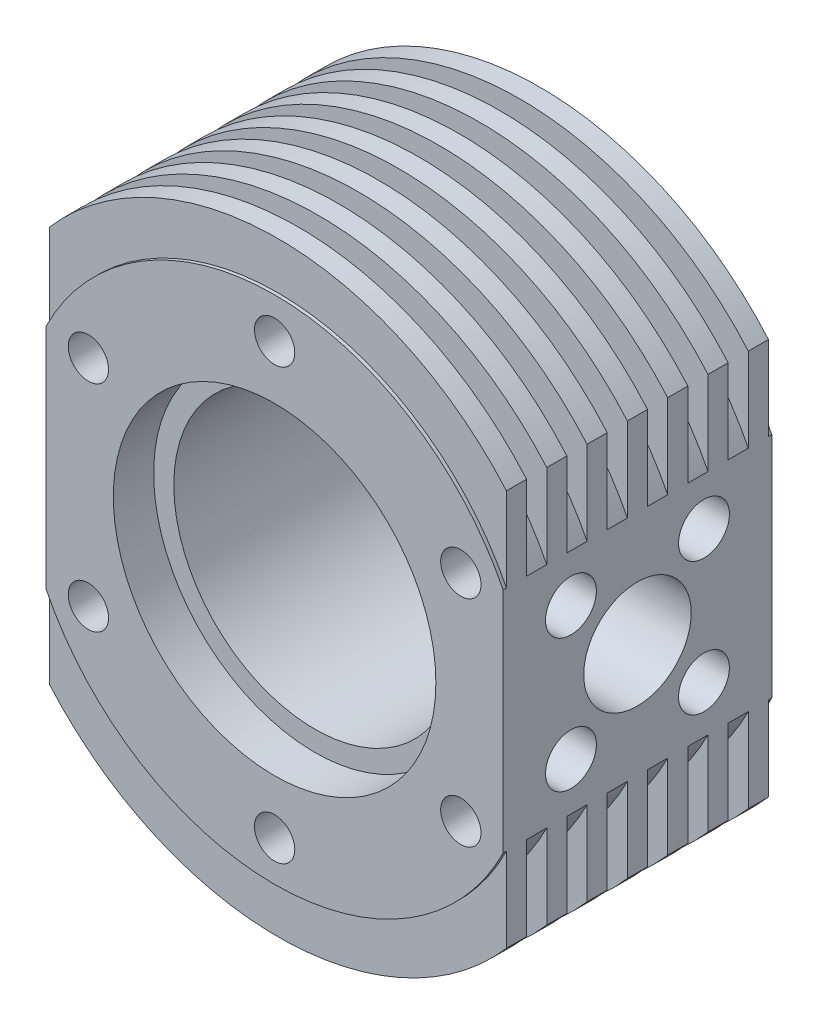
from build123d import *

# Parameters (mm, degrees)
SKETCH1_R            = 10.5
BOSS_EXTRUDE1_DEPTH  = 20
SKETCH2_R            = 12
CUT_EXTRUDE1_DEPTH   = 3
SKETCH4_OUTSIDE_W    = 47.968
SKETCH4_OUTSIDE_H    = 58.968
SKETCH4_OUTSIDE_R    = 19
CUT_EXTRUDE2_DEPTH   = 0.25
SKETCH5_OUTSIDE_W    = 47.968
SKETCH5_OUTSIDE_H    = 58.968
SKETCH5_OUTSIDE_R    = 19
CUT_EXTRUDE3_DEPTH   = 0.25
CUT_EXTRUDE4_START   = -1.5
CUT_EXTRUDE4_DEPTH   = 1.5
LPATTERN1_COUNT      = 6
LPATTERN1_PITCH      = 3
MIRROR1_START        = -1.5
MIRROR1_COPY_1_DEPTH = 1.5
MIRROR1_COPY_2_DEPTH = 1.5
MIRROR1_COPY_3_DEPTH = 1.5
MIRROR1_COPY_4_DEPTH = 1.5
MIRROR1_COPY_5_DEPTH = 1.5
MIRROR1_COPY_6_DEPTH = 1.5
CUT_EXTRUDE5_REACH   = 47.412
SKETCH9_R            = 4
SKETCH10_R           = 1.892494472
CUT_EXTRUDE6_DEPTH   = 4
SKETCH12_R           = 1.5
CUT_EXTRUDE7_DEPTH   = 4


with BuildPart() as part:
    # Sketch1 → Boss-Extrude1 (new body)
    with BuildSketch(Plane.XY):
        with BuildLine():
            Line((17, -14.739402973), (17, 14.739402973))
            ThreePointArc((17, 14.739402973), (0, 22.5), (-17, 14.739402973))
            Line((-17, 14.739402973), (-17, -14.739402973))
            ThreePointArc((-17, -14.739402973), (0, -22.5), (17, -14.739402973))
        make_face()
        Circle(SKETCH1_R, mode=Mode.SUBTRACT)
    extrude(amount=BOSS_EXTRUDE1_DEPTH)

    # Sketch2 → Cut-Extrude1 (cut)
    with BuildSketch(Plane.XY.offset(20)):
        Circle(SKETCH2_R)
    extrude(amount=-CUT_EXTRUDE1_DEPTH, mode=Mode.SUBTRACT)

    # Sketch4 outside → Cut-Extrude2 (cut)
    with BuildSketch(Plane(origin=(0, 0, 0), x_dir=(-1, 0, 0), z_dir=(0, 0, -1))):
        Rectangle(SKETCH4_OUTSIDE_W, SKETCH4_OUTSIDE_H)
        Circle(SKETCH4_OUTSIDE_R, mode=Mode.SUBTRACT)
    extrude(amount=-CUT_EXTRUDE2_DEPTH, mode=Mode.SUBTRACT)

    # Sketch5 outside → Cut-Extrude3 (cut)
    with BuildSketch(Plane.XY.offset(20)):
        Rectangle(SKETCH5_OUTSIDE_W, SKETCH5_OUTSIDE_H)
        Circle(SKETCH5_OUTSIDE_R, mode=Mode.SUBTRACT)
    extrude(amount=-CUT_EXTRUDE3_DEPTH, mode=Mode.SUBTRACT)

    # Sketch6 → Cut-Extrude4 (cut)
    with BuildSketch(Plane.XY.offset(18.25).offset(CUT_EXTRUDE4_START)):
        with BuildLine():
            Line((17, 8.485281374), (17, 14.739402973))
            ThreePointArc((17, 14.739402973), (0, 22.5), (-17, 14.739402973))
            Line((-17, 14.739402973), (-17, 8.485281374))
            ThreePointArc((-17, 8.485281374), (0, 19), (17, 8.485281374))
        make_face()
    cut_extrude4 = extrude(amount=CUT_EXTRUDE4_DEPTH, mode=Mode.SUBTRACT)

    # LPattern1: Cut-Extrude4 ×6
    with Locations(*[(0, 0, -i * LPATTERN1_PITCH) for i in range(1, LPATTERN1_COUNT)]):
        add(cut_extrude4, mode=Mode.SUBTRACT)

    # Mirror1 copy 1 sketch → Mirror1 copy 1 (cut)
    with BuildSketch(Plane.XY.offset(15.25).offset(MIRROR1_START)):
        with BuildLine():
            Line((17, -8.485281374), (17, -14.739402973))
            ThreePointArc((17, -14.739402973), (0, -22.5), (-17, -14.739402973))
            Line((-17, -14.739402973), (-17, -8.485281374))
            ThreePointArc((-17, -8.485281374), (0, -19), (17, -8.485281374))
        make_face()
    extrude(amount=MIRROR1_COPY_1_DEPTH, mode=Mode.SUBTRACT)

    # Mirror1 copy 2 sketch → Mirror1 copy 2 (cut)
    with BuildSketch(Plane.XY.offset(12.25).offset(MIRROR1_START)):
        with BuildLine():
            Line((17, -8.485281374), (17, -14.739402973))
            ThreePointArc((17, -14.739402973), (0, -22.5), (-17, -14.739402973))
            Line((-17, -14.739402973), (-17, -8.485281374))
            ThreePointArc((-17, -8.485281374), (0, -19), (17, -8.485281374))
        make_face()
    extrude(amount=MIRROR1_COPY_2_DEPTH, mode=Mode.SUBTRACT)

    # Mirror1 copy 3 sketch → Mirror1 copy 3 (cut)
    with BuildSketch(Plane.XY.offset(9.25).offset(MIRROR1_START)):
        with BuildLine():
            Line((17, -8.485281374), (17, -14.739402973))
            ThreePointArc((17, -14.739402973), (0, -22.5), (-17, -14.739402973))
            Line((-17, -14.739402973), (-17, -8.485281374))
            ThreePointArc((-17, -8.485281374), (0, -19), (17, -8.485281374))
        make_face()
    extrude(amount=MIRROR1_COPY_3_DEPTH, mode=Mode.SUBTRACT)

    # Mirror1 copy 4 sketch → Mirror1 copy 4 (cut)
    with BuildSketch(Plane.XY.offset(6.25).offset(MIRROR1_START)):
        with BuildLine():
            Line((17, -8.485281374), (17, -14.739402973))
            ThreePointArc((17, -14.739402973), (0, -22.5), (-17, -14.739402973))
            Line((-17, -14.739402973), (-17, -8.485281374))
            ThreePointArc((-17, -8.485281374), (0, -19), (17, -8.485281374))
        make_face()
    extrude(amount=MIRROR1_COPY_4_DEPTH, mode=Mode.SUBTRACT)

    # Mirror1 copy 5 sketch → Mirror1 copy 5 (cut)
    with BuildSketch(Plane.XY.offset(3.25).offset(MIRROR1_START)):
        with BuildLine():
            Line((17, -8.485281374), (17, -14.739402973))
            ThreePointArc((17, -14.739402973), (0, -22.5), (-17, -14.739402973))
            Line((-17, -14.739402973), (-17, -8.485281374))
            ThreePointArc((-17, -8.485281374), (0, -19), (17, -8.485281374))
        make_face()
    extrude(amount=MIRROR1_COPY_5_DEPTH, mode=Mode.SUBTRACT)

    # Mirror1 copy 6 sketch → Mirror1 copy 6 (cut)
    with BuildSketch(Plane.XY.offset(18.25).offset(MIRROR1_START)):
        with BuildLine():
            Line((17, -8.485281374), (17, -14.739402973))
            ThreePointArc((17, -14.739402973), (0, -22.5), (-17, -14.739402973))
            Line((-17, -14.739402973), (-17, -8.485281374))
            ThreePointArc((-17, -8.485281374), (0, -19), (17, -8.485281374))
        make_face()
    extrude(amount=MIRROR1_COPY_6_DEPTH, mode=Mode.SUBTRACT)

    # Sketch9 → Cut-Extrude5 (cut, up to next)
    with BuildSketch(Plane(origin=(17, 0, 0), x_dir=(0, 0, -1), z_dir=(1, 0, 0)), mode=Mode.PRIVATE) as cut_extrude5_sk1:
        with Locations((-10, 0)):
            Circle(SKETCH9_R)
    cut_extrude5_tool1 = extrude(cut_extrude5_sk1.sketch, amount=-CUT_EXTRUDE5_REACH, mode=Mode.PRIVATE) & part.part
    add(cut_extrude5_tool1.solids().sort_by_distance((17, 0, 10))[0], mode=Mode.SUBTRACT)

    # Sketch10 → Cut-Extrude6 (cut)
    with BuildSketch(Plane(origin=(17, 0, 0), x_dir=(0, 0, -1), z_dir=(1, 0, 0))):
        with Locations((-5.050252532, 4.949747468)):
            Circle(SKETCH10_R)
        with Locations((-5.050252532, -4.949747468)):
            Circle(SKETCH10_R)
        with Locations((-14.949747468, -4.949747468)):
            Circle(SKETCH10_R)
        with Locations((-14.949747468, 4.949747468)):
            Circle(SKETCH10_R)
    cut_extrude6 = extrude(amount=-CUT_EXTRUDE6_DEPTH, mode=Mode.SUBTRACT)

    # Sketch11 → Cut-Revolve1 (revolve, cut)
    with BuildSketch(Plane.XY.offset(10)):
        Polygon((-17, 0), (-11.5, 0), (-14.5, -3), (-17, -3), align=None)
    revolve(axis=Axis((-17, 0, 10), (1, 0, 0)), mode=Mode.SUBTRACT)

    # Mirror2: Cut-Extrude6 across plane
    add(cut_extrude6.mirror(Plane(origin=(0, 0, 0), x_dir=(0, 0, 1), z_dir=(1, 0, 0))), mode=Mode.SUBTRACT)

    # Sketch12 → Cut-Extrude7 (cut)
    with BuildSketch(Plane.XY.offset(20)):
        with Locations((0, 16)):
            Circle(SKETCH12_R)
        with Locations((13.856406461, 8)):
            Circle(SKETCH12_R)
        with Locations((13.856406461, -8)):
            Circle(SKETCH12_R)
        with Locations((0, -16)):
            Circle(SKETCH12_R)
        with Locations((-13.856406461, -8)):
            Circle(SKETCH12_R)
        with Locations((-13.856406461, 8)):
            Circle(SKETCH12_R)
    cut_extrude7 = extrude(amount=-CUT_EXTRUDE7_DEPTH, mode=Mode.SUBTRACT)

    # Mirror3: Cut-Extrude7 across plane
    add(cut_extrude7.mirror(Plane.XY.offset(10)), mode=Mode.SUBTRACT)


solid = part.part
